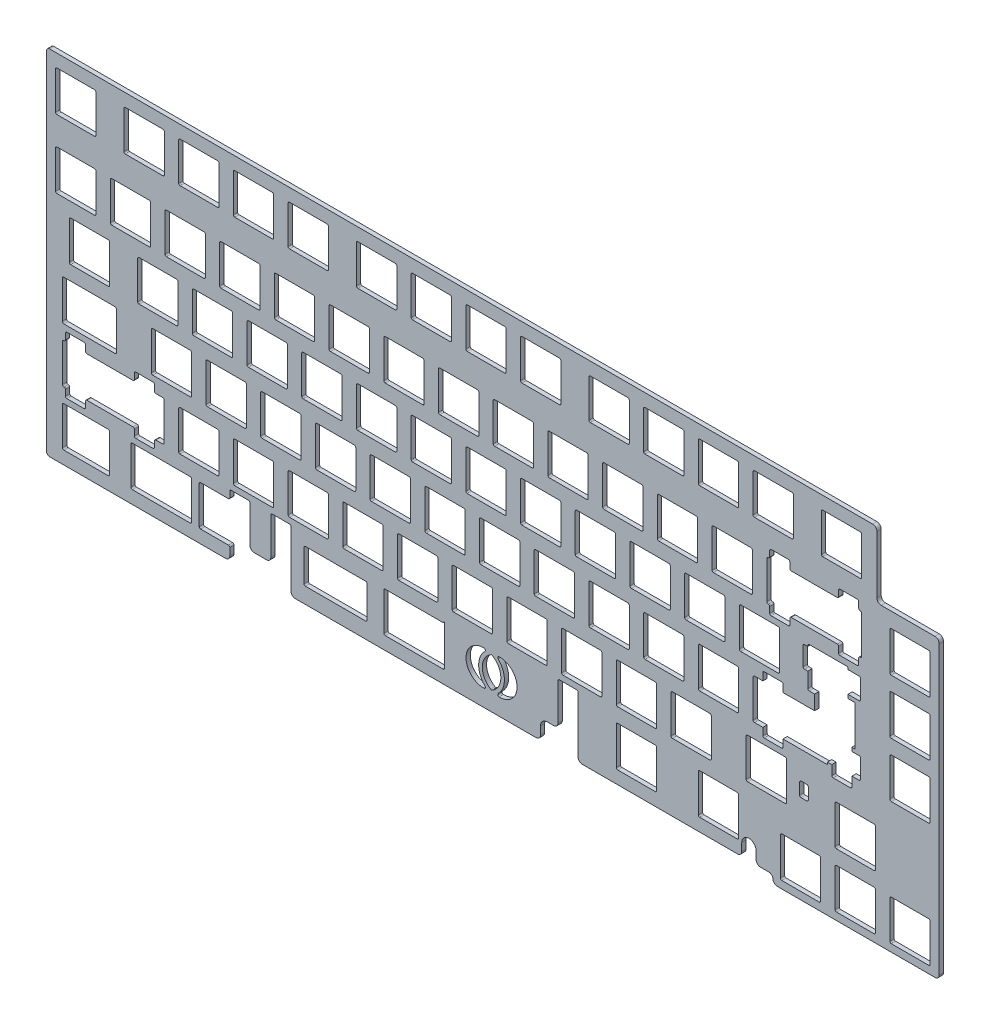
from build123d import *

# Parameters (mm, degrees)
BOSS_EXTRUDE1_DEPTH = 1.5
FILLET1_R           = 0.5


with BuildPart() as part:
    # Model → Boss-Extrude1 (new body)
    with BuildSketch(Plane.XY):
        with BuildLine():
            ThreePointArc((9.955298424, 130.969514546), (9.177480965, 130.647332005), (8.855298424, 129.869514546))
            Line((8.855298424, 129.869514546), (8.855298424, 9.057014546))
            ThreePointArc((8.855298424, 9.057014546), (9.177480965, 8.279197086), (9.955298424, 7.957014546))
            Line((9.955298424, 7.957014546), (71.206983424, 7.957014546))
            ThreePointArc((71.206983424, 7.957014546), (72.267643596, 8.396354374), (72.706983424, 9.457014546))
            Line((72.706983424, 9.457014546), (72.706983424, 11.957014546))
            ThreePointArc((72.706983424, 11.957014546), (72.560536815, 12.310567936), (72.206983424, 12.457014546))
            Line((72.206983424, 12.457014546), (62.559375038, 12.457014546))
            ThreePointArc((62.559375038, 12.457014546), (62.205821647, 12.603461155), (62.059375038, 12.957014546))
            Line((62.059375038, 12.957014546), (62.059375038, 25.957014546))
            ThreePointArc((62.059375038, 25.957014546), (62.205821647, 26.310567936), (62.559375038, 26.457014546))
            Line((62.559375038, 26.457014546), (72.206983424, 26.457014546))
            ThreePointArc((72.206983424, 26.457014546), (72.560536815, 26.603461155), (72.706983424, 26.957014546))
            Line((72.706983424, 26.957014546), (72.706983424, 28.958014546))
            ThreePointArc((72.706983424, 28.958014546), (72.853430033, 29.311567936), (73.206983424, 29.458014546))
            Line((73.206983424, 29.458014546), (79.206983424, 29.458014546))
            ThreePointArc((79.206983424, 29.458014546), (79.560536815, 29.311567936), (79.706983424, 28.958014546))
            Line((79.706983424, 28.958014546), (79.706983424, 16.157014546))
            ThreePointArc((79.706983424, 16.157014546), (80.146323252, 15.096354374), (81.206983424, 14.657014546))
            Line((81.206983424, 14.657014546), (85.495873424, 14.657014546))
            ThreePointArc((85.495873424, 14.657014546), (86.556533596, 15.096354374), (86.995873424, 16.157014546))
            Line((86.995873424, 16.157014546), (86.995873424, 28.958014546))
            ThreePointArc((86.995873424, 28.958014546), (87.142320033, 29.311567936), (87.495873424, 29.458014546))
            Line((87.495873424, 29.458014546), (93.495873424, 29.458014546))
            ThreePointArc((93.495873424, 29.458014546), (93.849426815, 29.311567936), (93.995873424, 28.958014546))
            Line((93.995873424, 28.958014546), (93.995873424, 9.457014546))
            ThreePointArc((93.995873424, 9.457014546), (94.435213252, 8.396354374), (95.495873424, 7.957014546))
            Line((95.495873424, 7.957014546), (179.362538424, 7.957014546))
            ThreePointArc((179.362538424, 7.957014546), (180.423198596, 8.396354374), (180.862538424, 9.457014546))
            Line((180.862538424, 9.457014546), (180.862538424, 12.157014546))
            ThreePointArc((180.862538424, 12.157014546), (181.594771471, 13.924781498), (183.362538424, 14.657014546))
            Line((183.362538424, 14.657014546), (185.495872282, 14.657014546))
            ThreePointArc((185.495872282, 14.657014546), (186.556532454, 15.096354374), (186.995872282, 16.157014546))
            Line((186.995872282, 16.157014546), (186.995872282, 28.958013975))
            ThreePointArc((186.995872282, 28.958013975), (187.14231869, 29.311567734), (187.495872282, 29.458014546))
            Line((187.495872282, 29.458014546), (193.495873424, 29.458014546))
            ThreePointArc((193.495873424, 29.458014546), (193.849426815, 29.311567936), (193.995873424, 28.958014546))
            Line((193.995873424, 28.958014546), (193.995873424, 9.457014546))
            ThreePointArc((193.995873424, 9.457014546), (194.435213252, 8.396354374), (195.495873424, 7.957014546))
            Line((195.495873424, 7.957014546), (249.492798424, 7.957014546))
            ThreePointArc((249.492798424, 7.957014546), (250.553458596, 8.396354374), (250.992798424, 9.457014546))
            Line((250.992798424, 9.457014546), (250.992798424, 12.157014546))
            ThreePointArc((250.992798424, 12.157014546), (253.492798424, 14.657014546), (255.992798424, 12.157014546))
            Line((255.992798424, 12.157014546), (255.992798424, 9.457014546))
            ThreePointArc((255.992798424, 9.457014546), (256.432138252, 8.396354374), (257.492798424, 7.957014546))
            Line((257.492798424, 7.957014546), (260.370951122, 7.957014546))
            ThreePointArc((260.370951122, 7.957014546), (261.407019411, 7.541709203), (261.869374773, 6.525764546))
            ThreePointArc((261.869374773, 6.525764546), (262.331730135, 5.509819888), (263.367798424, 5.094514546))
            Line((263.367798424, 5.094514546), (318.267798424, 5.094514546))
            ThreePointArc((318.267798424, 5.094514546), (319.328458596, 5.533854374), (319.767798424, 6.594514546))
            Line((319.767798424, 6.594514546), (319.767798424, 106.45317864))
            ThreePointArc((319.767798424, 106.45317864), (319.328458596, 107.513838812), (318.267798424, 107.95317864))
            Line((318.267798424, 107.95317864), (299.555298424, 107.95317864))
            ThreePointArc((299.555298424, 107.95317864), (298.494638252, 108.392518468), (298.055298424, 109.45317864))
            Line((298.055298424, 109.45317864), (298.055298424, 129.469514546))
            ThreePointArc((298.055298424, 129.469514546), (297.615958596, 130.530174717), (296.555298424, 130.969514546))
            Line((296.555298424, 130.969514546), (9.955298424, 130.969514546))
        make_face()
        with BuildLine():
            ThreePointArc((14.934285038, 12.457014546), (14.580731647, 12.603461155), (14.434285038, 12.957014546))
            Line((14.434285038, 12.957014546), (14.434285038, 25.957014546))
            ThreePointArc((14.434285038, 25.957014546), (14.580731647, 26.310567936), (14.934285038, 26.457014546))
            Line((14.934285038, 26.457014546), (30.319483424, 26.457014546))
            ThreePointArc((30.319483424, 26.457014546), (30.673036815, 26.310567936), (30.819483424, 25.957014546))
            Line((30.819483424, 25.957014546), (30.819483424, 12.957014546))
            ThreePointArc((30.819483424, 12.957014546), (30.673036815, 12.603461155), (30.319483424, 12.457014546))
            Line((30.319483424, 12.457014546), (14.934285038, 12.457014546))
        make_face(mode=Mode.SUBTRACT)
        with BuildLine():
            ThreePointArc((38.745375038, 12.457014546), (38.391821647, 12.603461155), (38.245375038, 12.957014546))
            Line((38.245375038, 12.957014546), (38.245375038, 25.957014546))
            ThreePointArc((38.245375038, 25.957014546), (38.391821647, 26.310567936), (38.745375038, 26.457014546))
            Line((38.745375038, 26.457014546), (58.894483424, 26.457014546))
            ThreePointArc((58.894483424, 26.457014546), (59.248036815, 26.310567936), (59.394483424, 25.957014546))
            Line((59.394483424, 25.957014546), (59.394483424, 12.957014546))
            ThreePointArc((59.394483424, 12.957014546), (59.248036815, 12.603461155), (58.894483424, 12.457014546))
            Line((58.894483424, 12.457014546), (38.745375038, 12.457014546))
        make_face(mode=Mode.SUBTRACT)
        with BuildLine():
            Line((120.541283424, 24.957014546), (120.541283424, 13.957014546))
            ThreePointArc((120.541283424, 13.957014546), (120.394836815, 13.603461155), (120.041283424, 13.457014546))
            Line((120.041283424, 13.457014546), (99.041283424, 13.457014546))
            ThreePointArc((99.041283424, 13.457014546), (98.687730033, 13.603461155), (98.541283424, 13.957014546))
            Line((98.541283424, 13.957014546), (98.541283424, 24.957014546))
            ThreePointArc((98.541283424, 24.957014546), (98.687730033, 25.310567936), (99.041283424, 25.457014546))
            Line((99.041283424, 25.457014546), (120.041283424, 25.457014546))
            ThreePointArc((120.041283424, 25.457014546), (120.394836815, 25.310567936), (120.541283424, 24.957014546))
        make_face(mode=Mode.SUBTRACT)
        with BuildLine():
            ThreePointArc((126.856983424, 12.457014546), (126.503430033, 12.603461155), (126.356983424, 12.957014546))
            Line((126.356983424, 12.957014546), (126.356983424, 25.957014546))
            ThreePointArc((126.356983424, 25.957014546), (126.503430033, 26.310567936), (126.856983424, 26.457014546))
            Line((126.856983424, 26.457014546), (146.995875038, 26.457014546))
            ThreePointArc((146.995875038, 26.457014546), (147.192055678, 26.702383251), (147.495875038, 26.782298463))
            Line((147.495875038, 26.782298463), (147.495875038, 12.957014546))
            ThreePointArc((147.495875038, 12.957014546), (147.349428429, 12.603461155), (146.995875038, 12.457014546))
            Line((146.995875038, 12.457014546), (126.856983424, 12.457014546))
        make_face(mode=Mode.SUBTRACT)
        with BuildLine():
            Line((15.463233424, 46.007014546), (15.463233424, 48.007314546))
            ThreePointArc((15.463233424, 48.007314546), (15.609680033, 48.360867936), (15.963233424, 48.507314546))
            Line((15.963233424, 48.507314546), (21.963233424, 48.507314546))
            ThreePointArc((21.963233424, 48.507314546), (22.316786815, 48.360867936), (22.463233424, 48.007314546))
            Line((22.463233424, 48.007314546), (22.463233424, 46.007314546))
            ThreePointArc((22.463233424, 46.007314546), (22.609680033, 45.653761155), (22.963233424, 45.507314546))
            Line((22.963233424, 45.507314546), (38.963233424, 45.507314546))
            ThreePointArc((38.963233424, 45.507314546), (39.316786815, 45.653761155), (39.463233424, 46.007314546))
            Line((39.463233424, 46.007314546), (39.463233424, 48.007314546))
            ThreePointArc((39.463233424, 48.007314546), (39.609680033, 48.360867936), (39.963233424, 48.507314546))
            Line((39.963233424, 48.507314546), (45.963233424, 48.507314546))
            ThreePointArc((45.963233424, 48.507314546), (46.316786815, 48.360867936), (46.463233424, 48.007314546))
            Line((46.463233424, 48.007314546), (46.463233424, 46.007014546))
            ThreePointArc((46.463233424, 46.007014546), (46.609680033, 45.653461155), (46.963233424, 45.507014546))
            Line((46.963233424, 45.507014546), (49.367798424, 45.507014546))
            ThreePointArc((49.367798424, 45.507014546), (49.721351815, 45.360567936), (49.867798424, 45.007014546))
            Line((49.867798424, 45.007014546), (49.867798424, 32.007014546))
            ThreePointArc((49.867798424, 32.007014546), (49.721351815, 31.653461155), (49.367798424, 31.507014546))
            Line((49.367798424, 31.507014546), (46.963233424, 31.507014546))
            ThreePointArc((46.963233424, 31.507014546), (46.609680033, 31.360567936), (46.463233424, 31.007014546))
            Line((46.463233424, 31.007014546), (46.463233424, 29.007314546))
            ThreePointArc((46.463233424, 29.007314546), (46.316786815, 28.653761155), (45.963233424, 28.507314546))
            Line((45.963233424, 28.507314546), (39.963233424, 28.507314546))
            ThreePointArc((39.963233424, 28.507314546), (39.609680033, 28.653761155), (39.463233424, 29.007314546))
            Line((39.463233424, 29.007314546), (39.463233424, 31.007314546))
            ThreePointArc((39.463233424, 31.007314546), (39.316786815, 31.360867936), (38.963233424, 31.507314546))
            Line((38.963233424, 31.507314546), (22.963233424, 31.507314546))
            ThreePointArc((22.963233424, 31.507314546), (22.609680033, 31.360867936), (22.463233424, 31.007314546))
            Line((22.463233424, 31.007314546), (22.463233424, 29.007314546))
            ThreePointArc((22.463233424, 29.007314546), (22.316786815, 28.653761155), (21.963233424, 28.507314546))
            Line((21.963233424, 28.507314546), (15.963233424, 28.507314546))
            ThreePointArc((15.963233424, 28.507314546), (15.609680033, 28.653761155), (15.463233424, 29.007314546))
            Line((15.463233424, 29.007314546), (15.463233424, 31.007014546))
            ThreePointArc((15.463233424, 31.007014546), (15.316786815, 31.360567936), (14.963233424, 31.507014546))
            Line((14.963233424, 31.507014546), (14.936548424, 31.507014546))
            ThreePointArc((14.936548424, 31.507014546), (14.582995033, 31.653461155), (14.436548424, 32.007014546))
            Line((14.436548424, 32.007014546), (14.436548424, 45.007014546))
            ThreePointArc((14.436548424, 45.007014546), (14.582995033, 45.360567936), (14.936548424, 45.507014546))
            Line((14.936548424, 45.507014546), (14.963233424, 45.507014546))
            ThreePointArc((14.963233424, 45.507014546), (15.316786815, 45.653461155), (15.463233424, 46.007014546))
        make_face(mode=Mode.SUBTRACT)
        with BuildLine():
            Line((68.442798424, 31.482014546), (55.392798424, 31.482014546))
            ThreePointArc((55.392798424, 31.482014546), (55.039245033, 31.628461155), (54.892798424, 31.982014546))
            Line((54.892798424, 31.982014546), (54.892798424, 45.032014546))
            ThreePointArc((54.892798424, 45.032014546), (55.039245033, 45.385567936), (55.392798424, 45.532014546))
            Line((55.392798424, 45.532014546), (68.442798424, 45.532014546))
            ThreePointArc((68.442798424, 45.532014546), (68.796351815, 45.385567936), (68.942798424, 45.032014546))
            Line((68.942798424, 45.032014546), (68.942798424, 31.982014546))
            ThreePointArc((68.942798424, 31.982014546), (68.796351815, 31.628461155), (68.442798424, 31.482014546))
        make_face(mode=Mode.SUBTRACT)
        with BuildLine():
            Line((87.492798424, 31.482014546), (74.442798424, 31.482014546))
            ThreePointArc((74.442798424, 31.482014546), (74.089245033, 31.628461155), (73.942798424, 31.982014546))
            Line((73.942798424, 31.982014546), (73.942798424, 45.032014546))
            ThreePointArc((73.942798424, 45.032014546), (74.089245033, 45.385567936), (74.442798424, 45.532014546))
            Line((74.442798424, 45.532014546), (87.492798424, 45.532014546))
            ThreePointArc((87.492798424, 45.532014546), (87.846351815, 45.385567936), (87.992798424, 45.032014546))
            Line((87.992798424, 45.032014546), (87.992798424, 31.982014546))
            ThreePointArc((87.992798424, 31.982014546), (87.846351815, 31.628461155), (87.492798424, 31.482014546))
        make_face(mode=Mode.SUBTRACT)
        with BuildLine():
            ThreePointArc((33.249048424, 51.057014546), (33.087957154, 50.668105816), (32.699048424, 50.507014546))
            Line((32.699048424, 50.507014546), (14.936548424, 50.507014546))
            ThreePointArc((14.936548424, 50.507014546), (14.547639694, 50.668105816), (14.386548424, 51.057014546))
            Line((14.386548424, 51.057014546), (14.386548424, 64.057014546))
            ThreePointArc((14.386548424, 64.057014546), (14.547639694, 64.445923275), (14.936548424, 64.607014546))
            Line((14.936548424, 64.607014546), (32.699048424, 64.607014546))
            ThreePointArc((32.699048424, 64.607014546), (33.087957154, 64.445923275), (33.249048424, 64.057014546))
            Line((33.249048424, 64.057014546), (33.249048424, 51.057014546))
        make_face(mode=Mode.SUBTRACT)
        with BuildLine():
            Line((58.917798424, 50.532014546), (45.867798424, 50.532014546))
            ThreePointArc((45.867798424, 50.532014546), (45.514245033, 50.678461155), (45.367798424, 51.032014546))
            Line((45.367798424, 51.032014546), (45.367798424, 64.082014546))
            ThreePointArc((45.367798424, 64.082014546), (45.514245033, 64.435567936), (45.867798424, 64.582014546))
            Line((45.867798424, 64.582014546), (58.917798424, 64.582014546))
            ThreePointArc((58.917798424, 64.582014546), (59.271351815, 64.435567936), (59.417798424, 64.082014546))
            Line((59.417798424, 64.082014546), (59.417798424, 51.032014546))
            ThreePointArc((59.417798424, 51.032014546), (59.271351815, 50.678461155), (58.917798424, 50.532014546))
        make_face(mode=Mode.SUBTRACT)
        with BuildLine():
            Line((77.967798424, 50.532014546), (64.917798424, 50.532014546))
            ThreePointArc((64.917798424, 50.532014546), (64.564245033, 50.678461155), (64.417798424, 51.032014546))
            Line((64.417798424, 51.032014546), (64.417798424, 64.082014546))
            ThreePointArc((64.417798424, 64.082014546), (64.564245033, 64.435567936), (64.917798424, 64.582014546))
            Line((64.917798424, 64.582014546), (77.967798424, 64.582014546))
            ThreePointArc((77.967798424, 64.582014546), (78.321351815, 64.435567936), (78.467798424, 64.082014546))
            Line((78.467798424, 64.082014546), (78.467798424, 51.032014546))
            ThreePointArc((78.467798424, 51.032014546), (78.321351815, 50.678461155), (77.967798424, 50.532014546))
        make_face(mode=Mode.SUBTRACT)
        with BuildLine():
            Line((106.542798424, 31.482014546), (93.492798424, 31.482014546))
            ThreePointArc((93.492798424, 31.482014546), (93.139245033, 31.628461155), (92.992798424, 31.982014546))
            Line((92.992798424, 31.982014546), (92.992798424, 45.032014546))
            ThreePointArc((92.992798424, 45.032014546), (93.139245033, 45.385567936), (93.492798424, 45.532014546))
            Line((93.492798424, 45.532014546), (106.542798424, 45.532014546))
            ThreePointArc((106.542798424, 45.532014546), (106.896351815, 45.385567936), (107.042798424, 45.032014546))
            Line((107.042798424, 45.032014546), (107.042798424, 31.982014546))
            ThreePointArc((107.042798424, 31.982014546), (106.896351815, 31.628461155), (106.542798424, 31.482014546))
        make_face(mode=Mode.SUBTRACT)
        with BuildLine():
            Line((125.592798424, 31.482014546), (112.542798424, 31.482014546))
            ThreePointArc((112.542798424, 31.482014546), (112.189245033, 31.628461155), (112.042798424, 31.982014546))
            Line((112.042798424, 31.982014546), (112.042798424, 45.032014546))
            ThreePointArc((112.042798424, 45.032014546), (112.189245033, 45.385567936), (112.542798424, 45.532014546))
            Line((112.542798424, 45.532014546), (125.592798424, 45.532014546))
            ThreePointArc((125.592798424, 45.532014546), (125.946351815, 45.385567936), (126.092798424, 45.032014546))
            Line((126.092798424, 45.032014546), (126.092798424, 31.982014546))
            ThreePointArc((126.092798424, 31.982014546), (125.946351815, 31.628461155), (125.592798424, 31.482014546))
        make_face(mode=Mode.SUBTRACT)
        with BuildLine():
            Line((144.642798424, 31.482014546), (131.592798424, 31.482014546))
            ThreePointArc((131.592798424, 31.482014546), (131.239245033, 31.628461155), (131.092798424, 31.982014546))
            Line((131.092798424, 31.982014546), (131.092798424, 45.032014546))
            ThreePointArc((131.092798424, 45.032014546), (131.239245033, 45.385567936), (131.592798424, 45.532014546))
            Line((131.592798424, 45.532014546), (144.642798424, 45.532014546))
            ThreePointArc((144.642798424, 45.532014546), (144.996351815, 45.385567936), (145.142798424, 45.032014546))
            Line((145.142798424, 45.032014546), (145.142798424, 31.982014546))
            ThreePointArc((145.142798424, 31.982014546), (144.996351815, 31.628461155), (144.642798424, 31.482014546))
        make_face(mode=Mode.SUBTRACT)
        with BuildLine():
            Line((163.692798424, 31.482014546), (150.642798424, 31.482014546))
            ThreePointArc((150.642798424, 31.482014546), (150.289245033, 31.628461155), (150.142798424, 31.982014546))
            Line((150.142798424, 31.982014546), (150.142798424, 45.032014546))
            ThreePointArc((150.142798424, 45.032014546), (150.289245033, 45.385567936), (150.642798424, 45.532014546))
            Line((150.642798424, 45.532014546), (163.692798424, 45.532014546))
            ThreePointArc((163.692798424, 45.532014546), (164.046351815, 45.385567936), (164.192798424, 45.032014546))
            Line((164.192798424, 45.032014546), (164.192798424, 31.982014546))
            ThreePointArc((164.192798424, 31.982014546), (164.046351815, 31.628461155), (163.692798424, 31.482014546))
        make_face(mode=Mode.SUBTRACT)
        with BuildLine():
            Line((97.017798424, 50.532014546), (83.967798424, 50.532014546))
            ThreePointArc((83.967798424, 50.532014546), (83.614245033, 50.678461155), (83.467798424, 51.032014546))
            Line((83.467798424, 51.032014546), (83.467798424, 64.082014546))
            ThreePointArc((83.467798424, 64.082014546), (83.614245033, 64.435567936), (83.967798424, 64.582014546))
            Line((83.967798424, 64.582014546), (97.017798424, 64.582014546))
            ThreePointArc((97.017798424, 64.582014546), (97.371351815, 64.435567936), (97.517798424, 64.082014546))
            Line((97.517798424, 64.082014546), (97.517798424, 51.032014546))
            ThreePointArc((97.517798424, 51.032014546), (97.371351815, 50.678461155), (97.017798424, 50.532014546))
        make_face(mode=Mode.SUBTRACT)
        with BuildLine():
            Line((116.067798424, 50.532014546), (103.017798424, 50.532014546))
            ThreePointArc((103.017798424, 50.532014546), (102.664245033, 50.678461155), (102.517798424, 51.032014546))
            Line((102.517798424, 51.032014546), (102.517798424, 64.082014546))
            ThreePointArc((102.517798424, 64.082014546), (102.664245033, 64.435567936), (103.017798424, 64.582014546))
            Line((103.017798424, 64.582014546), (116.067798424, 64.582014546))
            ThreePointArc((116.067798424, 64.582014546), (116.421351815, 64.435567936), (116.567798424, 64.082014546))
            Line((116.567798424, 64.082014546), (116.567798424, 51.032014546))
            ThreePointArc((116.567798424, 51.032014546), (116.421351815, 50.678461155), (116.067798424, 50.532014546))
        make_face(mode=Mode.SUBTRACT)
        with BuildLine():
            Line((135.117798424, 50.532014546), (122.067798424, 50.532014546))
            ThreePointArc((122.067798424, 50.532014546), (121.714245033, 50.678461155), (121.567798424, 51.032014546))
            Line((121.567798424, 51.032014546), (121.567798424, 64.082014546))
            ThreePointArc((121.567798424, 64.082014546), (121.714245033, 64.435567936), (122.067798424, 64.582014546))
            Line((122.067798424, 64.582014546), (135.117798424, 64.582014546))
            ThreePointArc((135.117798424, 64.582014546), (135.471351815, 64.435567936), (135.617798424, 64.082014546))
            Line((135.617798424, 64.082014546), (135.617798424, 51.032014546))
            ThreePointArc((135.617798424, 51.032014546), (135.471351815, 50.678461155), (135.117798424, 50.532014546))
        make_face(mode=Mode.SUBTRACT)
        with BuildLine():
            Line((154.167798424, 50.532014546), (141.117798424, 50.532014546))
            ThreePointArc((141.117798424, 50.532014546), (140.764245033, 50.678461155), (140.617798424, 51.032014546))
            Line((140.617798424, 51.032014546), (140.617798424, 64.082014546))
            ThreePointArc((140.617798424, 64.082014546), (140.764245033, 64.435567936), (141.117798424, 64.582014546))
            Line((141.117798424, 64.582014546), (154.167798424, 64.582014546))
            ThreePointArc((154.167798424, 64.582014546), (154.521351815, 64.435567936), (154.667798424, 64.082014546))
            Line((154.667798424, 64.082014546), (154.667798424, 51.032014546))
            ThreePointArc((154.667798424, 51.032014546), (154.521351815, 50.678461155), (154.167798424, 50.532014546))
        make_face(mode=Mode.SUBTRACT)
        with BuildLine():
            Line((220.842798424, 12.432014546), (207.792798424, 12.432014546))
            ThreePointArc((207.792798424, 12.432014546), (207.439245033, 12.578461155), (207.292798424, 12.932014546))
            Line((207.292798424, 12.932014546), (207.292798424, 25.982014546))
            ThreePointArc((207.292798424, 25.982014546), (207.439245033, 26.335567936), (207.792798424, 26.482014546))
            Line((207.792798424, 26.482014546), (220.842798424, 26.482014546))
            ThreePointArc((220.842798424, 26.482014546), (221.196351815, 26.335567936), (221.342798424, 25.982014546))
            Line((221.342798424, 25.982014546), (221.342798424, 12.932014546))
            ThreePointArc((221.342798424, 12.932014546), (221.196351815, 12.578461155), (220.842798424, 12.432014546))
        make_face(mode=Mode.SUBTRACT)
        with BuildLine():
            Line((249.417798424, 12.432014546), (236.367798424, 12.432014546))
            ThreePointArc((236.367798424, 12.432014546), (236.014245033, 12.578461155), (235.867798424, 12.932014546))
            Line((235.867798424, 12.932014546), (235.867798424, 25.982014546))
            ThreePointArc((235.867798424, 25.982014546), (236.014245033, 26.335567936), (236.367798424, 26.482014546))
            Line((236.367798424, 26.482014546), (249.417798424, 26.482014546))
            ThreePointArc((249.417798424, 26.482014546), (249.771351815, 26.335567936), (249.917798424, 25.982014546))
            Line((249.917798424, 25.982014546), (249.917798424, 12.932014546))
            ThreePointArc((249.917798424, 12.932014546), (249.771351815, 12.578461155), (249.417798424, 12.432014546))
        make_face(mode=Mode.SUBTRACT)
        with BuildLine():
            Line((277.992798424, 7.669514546), (264.942798424, 7.669514546))
            ThreePointArc((264.942798424, 7.669514546), (264.589245033, 7.815961155), (264.442798424, 8.169514546))
            Line((264.442798424, 8.169514546), (264.442798424, 21.219514546))
            ThreePointArc((264.442798424, 21.219514546), (264.589245033, 21.573067936), (264.942798424, 21.719514546))
            Line((264.942798424, 21.719514546), (277.992798424, 21.719514546))
            ThreePointArc((277.992798424, 21.719514546), (278.346351815, 21.573067936), (278.492798424, 21.219514546))
            Line((278.492798424, 21.219514546), (278.492798424, 8.169514546))
            ThreePointArc((278.492798424, 8.169514546), (278.346351815, 7.815961155), (277.992798424, 7.669514546))
        make_face(mode=Mode.SUBTRACT)
        with BuildLine():
            Line((297.042798424, 7.669514546), (283.992798424, 7.669514546))
            ThreePointArc((283.992798424, 7.669514546), (283.639245033, 7.815961155), (283.492798424, 8.169514546))
            Line((283.492798424, 8.169514546), (283.492798424, 21.219514546))
            ThreePointArc((283.492798424, 21.219514546), (283.639245033, 21.573067936), (283.992798424, 21.719514546))
            Line((283.992798424, 21.719514546), (297.042798424, 21.719514546))
            ThreePointArc((297.042798424, 21.719514546), (297.396351815, 21.573067936), (297.542798424, 21.219514546))
            Line((297.542798424, 21.219514546), (297.542798424, 8.169514546))
            ThreePointArc((297.542798424, 8.169514546), (297.396351815, 7.815961155), (297.042798424, 7.669514546))
        make_face(mode=Mode.SUBTRACT)
        with BuildLine():
            Line((316.092798424, 7.669514546), (303.042798424, 7.669514546))
            ThreePointArc((303.042798424, 7.669514546), (302.689245033, 7.815961155), (302.542798424, 8.169514546))
            Line((302.542798424, 8.169514546), (302.542798424, 21.219514546))
            ThreePointArc((302.542798424, 21.219514546), (302.689245033, 21.573067936), (303.042798424, 21.719514546))
            Line((303.042798424, 21.719514546), (316.092798424, 21.719514546))
            ThreePointArc((316.092798424, 21.719514546), (316.446351815, 21.573067936), (316.592798424, 21.219514546))
            Line((316.592798424, 21.219514546), (316.592798424, 8.169514546))
            ThreePointArc((316.592798424, 8.169514546), (316.446351815, 7.815961155), (316.092798424, 7.669514546))
        make_face(mode=Mode.SUBTRACT)
        with BuildLine():
            Line((297.042798424, 26.719514546), (283.992798424, 26.719514546))
            ThreePointArc((283.992798424, 26.719514546), (283.639245033, 26.865961155), (283.492798424, 27.219514546))
            Line((283.492798424, 27.219514546), (283.492798424, 40.269514546))
            ThreePointArc((283.492798424, 40.269514546), (283.639245033, 40.623067936), (283.992798424, 40.769514546))
            Line((283.992798424, 40.769514546), (297.042798424, 40.769514546))
            ThreePointArc((297.042798424, 40.769514546), (297.396351815, 40.623067936), (297.542798424, 40.269514546))
            Line((297.542798424, 40.269514546), (297.542798424, 27.219514546))
            ThreePointArc((297.542798424, 27.219514546), (297.396351815, 26.865961155), (297.042798424, 26.719514546))
        make_face(mode=Mode.SUBTRACT)
        with BuildLine():
            Line((182.742798424, 31.482014546), (169.692798424, 31.482014546))
            ThreePointArc((169.692798424, 31.482014546), (169.339245033, 31.628461155), (169.192798424, 31.982014546))
            Line((169.192798424, 31.982014546), (169.192798424, 45.032014546))
            ThreePointArc((169.192798424, 45.032014546), (169.339245033, 45.385567936), (169.692798424, 45.532014546))
            Line((169.692798424, 45.532014546), (182.742798424, 45.532014546))
            ThreePointArc((182.742798424, 45.532014546), (183.096351815, 45.385567936), (183.242798424, 45.032014546))
            Line((183.242798424, 45.032014546), (183.242798424, 31.982014546))
            ThreePointArc((183.242798424, 31.982014546), (183.096351815, 31.628461155), (182.742798424, 31.482014546))
        make_face(mode=Mode.SUBTRACT)
        with BuildLine():
            Line((201.792798424, 31.482014546), (188.742798424, 31.482014546))
            ThreePointArc((188.742798424, 31.482014546), (188.389245033, 31.628461155), (188.242798424, 31.982014546))
            Line((188.242798424, 31.982014546), (188.242798424, 45.032014546))
            ThreePointArc((188.242798424, 45.032014546), (188.389245033, 45.385567936), (188.742798424, 45.532014546))
            Line((188.742798424, 45.532014546), (201.792798424, 45.532014546))
            ThreePointArc((201.792798424, 45.532014546), (202.146351815, 45.385567936), (202.292798424, 45.032014546))
            Line((202.292798424, 45.032014546), (202.292798424, 31.982014546))
            ThreePointArc((202.292798424, 31.982014546), (202.146351815, 31.628461155), (201.792798424, 31.482014546))
        make_face(mode=Mode.SUBTRACT)
        with BuildLine():
            Line((220.842798424, 31.482014546), (207.792798424, 31.482014546))
            ThreePointArc((207.792798424, 31.482014546), (207.439245033, 31.628461155), (207.292798424, 31.982014546))
            Line((207.292798424, 31.982014546), (207.292798424, 45.032014546))
            ThreePointArc((207.292798424, 45.032014546), (207.439245033, 45.385567936), (207.792798424, 45.532014546))
            Line((207.792798424, 45.532014546), (220.842798424, 45.532014546))
            ThreePointArc((220.842798424, 45.532014546), (221.196351815, 45.385567936), (221.342798424, 45.032014546))
            Line((221.342798424, 45.032014546), (221.342798424, 31.982014546))
            ThreePointArc((221.342798424, 31.982014546), (221.196351815, 31.628461155), (220.842798424, 31.482014546))
        make_face(mode=Mode.SUBTRACT)
        with BuildLine():
            Line((239.892798424, 31.482014546), (226.842798424, 31.482014546))
            ThreePointArc((226.842798424, 31.482014546), (226.489245033, 31.628461155), (226.342798424, 31.982014546))
            Line((226.342798424, 31.982014546), (226.342798424, 45.032014546))
            ThreePointArc((226.342798424, 45.032014546), (226.489245033, 45.385567936), (226.842798424, 45.532014546))
            Line((226.842798424, 45.532014546), (239.892798424, 45.532014546))
            ThreePointArc((239.892798424, 45.532014546), (240.246351815, 45.385567936), (240.392798424, 45.032014546))
            Line((240.392798424, 45.032014546), (240.392798424, 31.982014546))
            ThreePointArc((240.392798424, 31.982014546), (240.246351815, 31.628461155), (239.892798424, 31.482014546))
        make_face(mode=Mode.SUBTRACT)
        with BuildLine():
            Line((173.217798424, 50.532014546), (160.167798424, 50.532014546))
            ThreePointArc((160.167798424, 50.532014546), (159.814245033, 50.678461155), (159.667798424, 51.032014546))
            Line((159.667798424, 51.032014546), (159.667798424, 64.082014546))
            ThreePointArc((159.667798424, 64.082014546), (159.814245033, 64.435567936), (160.167798424, 64.582014546))
            Line((160.167798424, 64.582014546), (173.217798424, 64.582014546))
            ThreePointArc((173.217798424, 64.582014546), (173.571351815, 64.435567936), (173.717798424, 64.082014546))
            Line((173.717798424, 64.082014546), (173.717798424, 51.032014546))
            ThreePointArc((173.717798424, 51.032014546), (173.571351815, 50.678461155), (173.217798424, 50.532014546))
        make_face(mode=Mode.SUBTRACT)
        with BuildLine():
            Line((192.267798424, 50.532014546), (179.217798424, 50.532014546))
            ThreePointArc((179.217798424, 50.532014546), (178.864245033, 50.678461155), (178.717798424, 51.032014546))
            Line((178.717798424, 51.032014546), (178.717798424, 64.082014546))
            ThreePointArc((178.717798424, 64.082014546), (178.864245033, 64.435567936), (179.217798424, 64.582014546))
            Line((179.217798424, 64.582014546), (192.267798424, 64.582014546))
            ThreePointArc((192.267798424, 64.582014546), (192.621351815, 64.435567936), (192.767798424, 64.082014546))
            Line((192.767798424, 64.082014546), (192.767798424, 51.032014546))
            ThreePointArc((192.767798424, 51.032014546), (192.621351815, 50.678461155), (192.267798424, 50.532014546))
        make_face(mode=Mode.SUBTRACT)
        with BuildLine():
            Line((211.317798424, 50.532014546), (198.267798424, 50.532014546))
            ThreePointArc((198.267798424, 50.532014546), (197.914245033, 50.678461155), (197.767798424, 51.032014546))
            Line((197.767798424, 51.032014546), (197.767798424, 64.082014546))
            ThreePointArc((197.767798424, 64.082014546), (197.914245033, 64.435567936), (198.267798424, 64.582014546))
            Line((198.267798424, 64.582014546), (211.317798424, 64.582014546))
            ThreePointArc((211.317798424, 64.582014546), (211.671351815, 64.435567936), (211.817798424, 64.082014546))
            Line((211.817798424, 64.082014546), (211.817798424, 51.032014546))
            ThreePointArc((211.817798424, 51.032014546), (211.671351815, 50.678461155), (211.317798424, 50.532014546))
        make_face(mode=Mode.SUBTRACT)
        with BuildLine():
            Line((230.367798424, 50.532014546), (217.317798424, 50.532014546))
            ThreePointArc((217.317798424, 50.532014546), (216.964245033, 50.678461155), (216.817798424, 51.032014546))
            Line((216.817798424, 51.032014546), (216.817798424, 64.082014546))
            ThreePointArc((216.817798424, 64.082014546), (216.964245033, 64.435567936), (217.317798424, 64.582014546))
            Line((217.317798424, 64.582014546), (230.367798424, 64.582014546))
            ThreePointArc((230.367798424, 64.582014546), (230.721351815, 64.435567936), (230.867798424, 64.082014546))
            Line((230.867798424, 64.082014546), (230.867798424, 51.032014546))
            ThreePointArc((230.867798424, 51.032014546), (230.721351815, 50.678461155), (230.367798424, 50.532014546))
        make_face(mode=Mode.SUBTRACT)
        with BuildLine():
            Line((266.086548424, 31.482014546), (253.036548424, 31.482014546))
            ThreePointArc((253.036548424, 31.482014546), (252.682995033, 31.628461155), (252.536548424, 31.982014546))
            Line((252.536548424, 31.982014546), (252.536548424, 45.032014546))
            ThreePointArc((252.536548424, 45.032014546), (252.682995033, 45.385567936), (253.036548424, 45.532014546))
            Line((253.036548424, 45.532014546), (266.086548424, 45.532014546))
            ThreePointArc((266.086548424, 45.532014546), (266.440101815, 45.385567936), (266.586548424, 45.032014546))
            Line((266.586548424, 45.032014546), (266.586548424, 31.982014546))
            ThreePointArc((266.586548424, 31.982014546), (266.440101815, 31.628461155), (266.086548424, 31.482014546))
        make_face(mode=Mode.SUBTRACT)
        with BuildLine():
            ThreePointArc((271.157173424, 40.507014546), (271.303620033, 40.860567936), (271.657173424, 41.007014546))
            Line((271.657173424, 41.007014546), (273.657173424, 41.007014546))
            ThreePointArc((273.657173424, 41.007014546), (274.010726815, 40.860567936), (274.157173424, 40.507014546))
            Line((274.157173424, 40.507014546), (274.157173424, 36.507014546))
            ThreePointArc((274.157173424, 36.507014546), (274.010726815, 36.153461155), (273.657173424, 36.007014546))
            Line((273.657173424, 36.007014546), (271.657173424, 36.007014546))
            ThreePointArc((271.657173424, 36.007014546), (271.303620033, 36.153461155), (271.157173424, 36.507014546))
            Line((271.157173424, 36.507014546), (271.157173424, 40.507014546))
        make_face(mode=Mode.SUBTRACT)
        with BuildLine():
            Line((249.417798424, 50.532014546), (236.367798424, 50.532014546))
            ThreePointArc((236.367798424, 50.532014546), (236.014245033, 50.678461155), (235.867798424, 51.032014546))
            Line((235.867798424, 51.032014546), (235.867798424, 64.082014546))
            ThreePointArc((235.867798424, 64.082014546), (236.014245033, 64.435567936), (236.367798424, 64.582014546))
            Line((236.367798424, 64.582014546), (249.417798424, 64.582014546))
            ThreePointArc((249.417798424, 64.582014546), (249.771351815, 64.435567936), (249.917798424, 64.082014546))
            Line((249.917798424, 64.082014546), (249.917798424, 51.032014546))
            ThreePointArc((249.917798424, 51.032014546), (249.771351815, 50.678461155), (249.417798424, 50.532014546))
        make_face(mode=Mode.SUBTRACT)
        with BuildLine():
            ThreePointArc((273.992798424, 83.107014546), (274.139245033, 83.460567936), (274.492798424, 83.607014546))
            Line((274.492798424, 83.607014546), (287.492798424, 83.607014546))
            ThreePointArc((287.492798424, 83.607014546), (287.846351815, 83.460567936), (287.992798424, 83.107014546))
            Line((287.992798424, 83.107014546), (287.995298424, 82.780068193))
            Line((287.995298424, 82.780068193), (291.850783424, 82.780068193))
            ThreePointArc((291.850783424, 82.780068193), (292.204336815, 82.633621584), (292.350783424, 82.280068193))
            Line((292.350783424, 82.280068193), (292.350783424, 75.842068193))
            ThreePointArc((292.350783424, 75.842068193), (292.204336815, 75.488514803), (291.850783424, 75.342068193))
            Line((291.850783424, 75.342068193), (287.995298424, 75.342068193))
            Line((287.995298424, 75.342068193), (287.995298424, 74.061068193))
            Line((287.995298424, 74.061068193), (290.376548424, 74.061068193))
            Line((290.376548424, 74.061068193), (290.376548424, 60.061068193))
            Line((290.376548424, 60.061068193), (289.350783424, 60.061068193))
            Line((289.350783424, 60.061068193), (289.350783424, 58.780068193))
            Line((289.350783424, 58.780068193), (291.850783424, 58.780068193))
            ThreePointArc((291.850783424, 58.780068193), (292.204336815, 58.633621584), (292.350783424, 58.280068193))
            Line((292.350783424, 58.280068193), (292.350783424, 51.842068193))
            ThreePointArc((292.350783424, 51.842068193), (292.204336815, 51.488514803), (291.850783424, 51.342068193))
            Line((291.850783424, 51.342068193), (289.350783424, 51.342068193))
            Line((289.350783424, 51.342068193), (289.350783424, 48.057014546))
            ThreePointArc((289.350783424, 48.057014546), (289.204336815, 47.703461155), (288.850783424, 47.557014546))
            Line((288.850783424, 47.557014546), (282.850783424, 47.557014546))
            ThreePointArc((282.850783424, 47.557014546), (282.497230033, 47.703461155), (282.350783424, 48.057014546))
            Line((282.350783424, 48.057014546), (282.350783424, 51.342068193))
            Line((282.350783424, 51.342068193), (280.851598424, 51.342068193))
            Line((280.851598424, 51.342068193), (280.851598424, 50.557014546))
            Line((280.851598424, 50.557014546), (265.350783424, 50.557014546))
            Line((265.350783424, 50.557014546), (265.350783424, 48.057014546))
            ThreePointArc((265.350783424, 48.057014546), (265.204336815, 47.703461155), (264.850783424, 47.557014546))
            Line((264.850783424, 47.557014546), (258.850783424, 47.557014546))
            ThreePointArc((258.850783424, 47.557014546), (258.497230033, 47.703461155), (258.350783424, 48.057014546))
            Line((258.350783424, 48.057014546), (258.350783424, 50.557014546))
            Line((258.350783424, 50.557014546), (255.445298424, 50.557014546))
            ThreePointArc((255.445298424, 50.557014546), (255.091745033, 50.703461155), (254.945298424, 51.057014546))
            Line((254.945298424, 51.057014546), (254.945298424, 64.057014546))
            ThreePointArc((254.945298424, 64.057014546), (255.091745033, 64.410567936), (255.445298424, 64.557014546))
            Line((255.445298424, 64.557014546), (258.350783424, 64.557014546))
            Line((258.350783424, 64.557014546), (258.350783424, 67.057014546))
            ThreePointArc((258.350783424, 67.057014546), (258.497230033, 67.410567936), (258.850783424, 67.557014546))
            Line((258.850783424, 67.557014546), (264.850783424, 67.557014546))
            ThreePointArc((264.850783424, 67.557014546), (265.204336815, 67.410567936), (265.350783424, 67.057014546))
            Line((265.350783424, 67.057014546), (265.350783424, 64.557014546))
            Line((265.350783424, 64.557014546), (276.376548424, 64.557014546))
            Line((276.376548424, 64.557014546), (276.376548424, 69.607014546))
            Line((276.376548424, 69.607014546), (274.492798424, 69.607014546))
            ThreePointArc((274.492798424, 69.607014546), (274.139245033, 69.753461155), (273.992798424, 70.107014546))
            Line((273.992798424, 70.107014546), (273.992798424, 75.342068193))
            Line((273.992798424, 75.342068193), (272.850783424, 75.342068193))
            ThreePointArc((272.850783424, 75.342068193), (272.497230033, 75.488514803), (272.350783424, 75.842068193))
            Line((272.350783424, 75.842068193), (272.350783424, 82.280068193))
            ThreePointArc((272.350783424, 82.280068193), (272.497230033, 82.633621584), (272.850783424, 82.780068193))
            Line((272.850783424, 82.780068193), (273.992798424, 82.780068193))
            Line((273.992798424, 82.780068193), (273.992798424, 83.107014546))
        make_face(mode=Mode.SUBTRACT)
        with BuildLine():
            ThreePointArc((302.542798424, 64.057014546), (302.696567364, 64.428245606), (303.067798424, 64.582014546))
            Line((303.067798424, 64.582014546), (316.117798424, 64.582014546))
            ThreePointArc((316.117798424, 64.582014546), (316.453674145, 64.442890267), (316.592798424, 64.107014546))
            Line((316.592798424, 64.107014546), (316.592798424, 51.057014546))
            ThreePointArc((316.592798424, 51.057014546), (316.439029484, 50.685783485), (316.067798424, 50.532014546))
            Line((316.067798424, 50.532014546), (303.067798424, 50.532014546))
            ThreePointArc((303.067798424, 50.532014546), (302.696567364, 50.685783485), (302.542798424, 51.057014546))
            Line((302.542798424, 51.057014546), (302.542798424, 64.057014546))
        make_face(mode=Mode.SUBTRACT)
        with BuildLine():
            Line((30.342798424, 69.582014546), (17.292798424, 69.582014546))
            ThreePointArc((17.292798424, 69.582014546), (16.939245033, 69.728461155), (16.792798424, 70.082014546))
            Line((16.792798424, 70.082014546), (16.792798424, 83.132014546))
            ThreePointArc((16.792798424, 83.132014546), (16.939245033, 83.485567936), (17.292798424, 83.632014546))
            Line((17.292798424, 83.632014546), (30.342798424, 83.632014546))
            ThreePointArc((30.342798424, 83.632014546), (30.696351815, 83.485567936), (30.842798424, 83.132014546))
            Line((30.842798424, 83.132014546), (30.842798424, 70.082014546))
            ThreePointArc((30.842798424, 70.082014546), (30.696351815, 69.728461155), (30.342798424, 69.582014546))
        make_face(mode=Mode.SUBTRACT)
        with BuildLine():
            Line((54.155298424, 69.582014546), (41.105298424, 69.582014546))
            ThreePointArc((41.105298424, 69.582014546), (40.751745033, 69.728461155), (40.605298424, 70.082014546))
            Line((40.605298424, 70.082014546), (40.605298424, 83.132014546))
            ThreePointArc((40.605298424, 83.132014546), (40.751745033, 83.485567936), (41.105298424, 83.632014546))
            Line((41.105298424, 83.632014546), (54.155298424, 83.632014546))
            ThreePointArc((54.155298424, 83.632014546), (54.508851815, 83.485567936), (54.655298424, 83.132014546))
            Line((54.655298424, 83.132014546), (54.655298424, 70.082014546))
            ThreePointArc((54.655298424, 70.082014546), (54.508851815, 69.728461155), (54.155298424, 69.582014546))
        make_face(mode=Mode.SUBTRACT)
        with BuildLine():
            Line((73.205298424, 69.582014546), (60.155298424, 69.582014546))
            ThreePointArc((60.155298424, 69.582014546), (59.801745033, 69.728461155), (59.655298424, 70.082014546))
            Line((59.655298424, 70.082014546), (59.655298424, 83.132014546))
            ThreePointArc((59.655298424, 83.132014546), (59.801745033, 83.485567936), (60.155298424, 83.632014546))
            Line((60.155298424, 83.632014546), (73.205298424, 83.632014546))
            ThreePointArc((73.205298424, 83.632014546), (73.558851815, 83.485567936), (73.705298424, 83.132014546))
            Line((73.705298424, 83.132014546), (73.705298424, 70.082014546))
            ThreePointArc((73.705298424, 70.082014546), (73.558851815, 69.728461155), (73.205298424, 69.582014546))
        make_face(mode=Mode.SUBTRACT)
        with BuildLine():
            Line((92.255298424, 69.582014546), (79.205298424, 69.582014546))
            ThreePointArc((79.205298424, 69.582014546), (78.851745033, 69.728461155), (78.705298424, 70.082014546))
            Line((78.705298424, 70.082014546), (78.705298424, 83.132014546))
            ThreePointArc((78.705298424, 83.132014546), (78.851745033, 83.485567936), (79.205298424, 83.632014546))
            Line((79.205298424, 83.632014546), (92.255298424, 83.632014546))
            ThreePointArc((92.255298424, 83.632014546), (92.608851815, 83.485567936), (92.755298424, 83.132014546))
            Line((92.755298424, 83.132014546), (92.755298424, 70.082014546))
            ThreePointArc((92.755298424, 70.082014546), (92.608851815, 69.728461155), (92.255298424, 69.582014546))
        make_face(mode=Mode.SUBTRACT)
        with BuildLine():
            Line((25.580298424, 88.632014546), (12.530298424, 88.632014546))
            ThreePointArc((12.530298424, 88.632014546), (12.176745033, 88.778461155), (12.030298424, 89.132014546))
            Line((12.030298424, 89.132014546), (12.030298424, 102.182014546))
            ThreePointArc((12.030298424, 102.182014546), (12.176745033, 102.535567936), (12.530298424, 102.682014546))
            Line((12.530298424, 102.682014546), (25.580298424, 102.682014546))
            ThreePointArc((25.580298424, 102.682014546), (25.933851815, 102.535567936), (26.080298424, 102.182014546))
            Line((26.080298424, 102.182014546), (26.080298424, 89.132014546))
            ThreePointArc((26.080298424, 89.132014546), (25.933851815, 88.778461155), (25.580298424, 88.632014546))
        make_face(mode=Mode.SUBTRACT)
        with BuildLine():
            Line((44.630298424, 88.632014546), (31.580298424, 88.632014546))
            ThreePointArc((31.580298424, 88.632014546), (31.226745033, 88.778461155), (31.080298424, 89.132014546))
            Line((31.080298424, 89.132014546), (31.080298424, 102.182014546))
            ThreePointArc((31.080298424, 102.182014546), (31.226745033, 102.535567936), (31.580298424, 102.682014546))
            Line((31.580298424, 102.682014546), (44.630298424, 102.682014546))
            ThreePointArc((44.630298424, 102.682014546), (44.983851815, 102.535567936), (45.130298424, 102.182014546))
            Line((45.130298424, 102.182014546), (45.130298424, 89.132014546))
            ThreePointArc((45.130298424, 89.132014546), (44.983851815, 88.778461155), (44.630298424, 88.632014546))
        make_face(mode=Mode.SUBTRACT)
        with BuildLine():
            Line((63.680298424, 88.632014546), (50.630298424, 88.632014546))
            ThreePointArc((50.630298424, 88.632014546), (50.276745033, 88.778461155), (50.130298424, 89.132014546))
            Line((50.130298424, 89.132014546), (50.130298424, 102.182014546))
            ThreePointArc((50.130298424, 102.182014546), (50.276745033, 102.535567936), (50.630298424, 102.682014546))
            Line((50.630298424, 102.682014546), (63.680298424, 102.682014546))
            ThreePointArc((63.680298424, 102.682014546), (64.033851815, 102.535567936), (64.180298424, 102.182014546))
            Line((64.180298424, 102.182014546), (64.180298424, 89.132014546))
            ThreePointArc((64.180298424, 89.132014546), (64.033851815, 88.778461155), (63.680298424, 88.632014546))
        make_face(mode=Mode.SUBTRACT)
        with BuildLine():
            Line((82.730298424, 88.632014546), (69.680298424, 88.632014546))
            ThreePointArc((69.680298424, 88.632014546), (69.326745033, 88.778461155), (69.180298424, 89.132014546))
            Line((69.180298424, 89.132014546), (69.180298424, 102.182014546))
            ThreePointArc((69.180298424, 102.182014546), (69.326745033, 102.535567936), (69.680298424, 102.682014546))
            Line((69.680298424, 102.682014546), (82.730298424, 102.682014546))
            ThreePointArc((82.730298424, 102.682014546), (83.083851815, 102.535567936), (83.230298424, 102.182014546))
            Line((83.230298424, 102.182014546), (83.230298424, 89.132014546))
            ThreePointArc((83.230298424, 89.132014546), (83.083851815, 88.778461155), (82.730298424, 88.632014546))
        make_face(mode=Mode.SUBTRACT)
        with BuildLine():
            Line((111.305298424, 69.582014546), (98.255298424, 69.582014546))
            ThreePointArc((98.255298424, 69.582014546), (97.901745033, 69.728461155), (97.755298424, 70.082014546))
            Line((97.755298424, 70.082014546), (97.755298424, 83.132014546))
            ThreePointArc((97.755298424, 83.132014546), (97.901745033, 83.485567936), (98.255298424, 83.632014546))
            Line((98.255298424, 83.632014546), (111.305298424, 83.632014546))
            ThreePointArc((111.305298424, 83.632014546), (111.658851815, 83.485567936), (111.805298424, 83.132014546))
            Line((111.805298424, 83.132014546), (111.805298424, 70.082014546))
            ThreePointArc((111.805298424, 70.082014546), (111.658851815, 69.728461155), (111.305298424, 69.582014546))
        make_face(mode=Mode.SUBTRACT)
        with BuildLine():
            Line((130.355298424, 69.582014546), (117.305298424, 69.582014546))
            ThreePointArc((117.305298424, 69.582014546), (116.951745033, 69.728461155), (116.805298424, 70.082014546))
            Line((116.805298424, 70.082014546), (116.805298424, 83.132014546))
            ThreePointArc((116.805298424, 83.132014546), (116.951745033, 83.485567936), (117.305298424, 83.632014546))
            Line((117.305298424, 83.632014546), (130.355298424, 83.632014546))
            ThreePointArc((130.355298424, 83.632014546), (130.708851815, 83.485567936), (130.855298424, 83.132014546))
            Line((130.855298424, 83.132014546), (130.855298424, 70.082014546))
            ThreePointArc((130.855298424, 70.082014546), (130.708851815, 69.728461155), (130.355298424, 69.582014546))
        make_face(mode=Mode.SUBTRACT)
        with BuildLine():
            Line((149.405298424, 69.582014546), (136.355298424, 69.582014546))
            ThreePointArc((136.355298424, 69.582014546), (136.001745033, 69.728461155), (135.855298424, 70.082014546))
            Line((135.855298424, 70.082014546), (135.855298424, 83.132014546))
            ThreePointArc((135.855298424, 83.132014546), (136.001745033, 83.485567936), (136.355298424, 83.632014546))
            Line((136.355298424, 83.632014546), (149.405298424, 83.632014546))
            ThreePointArc((149.405298424, 83.632014546), (149.758851815, 83.485567936), (149.905298424, 83.132014546))
            Line((149.905298424, 83.132014546), (149.905298424, 70.082014546))
            ThreePointArc((149.905298424, 70.082014546), (149.758851815, 69.728461155), (149.405298424, 69.582014546))
        make_face(mode=Mode.SUBTRACT)
        with BuildLine():
            Line((168.455298424, 69.582014546), (155.405298424, 69.582014546))
            ThreePointArc((155.405298424, 69.582014546), (155.051745033, 69.728461155), (154.905298424, 70.082014546))
            Line((154.905298424, 70.082014546), (154.905298424, 83.132014546))
            ThreePointArc((154.905298424, 83.132014546), (155.051745033, 83.485567936), (155.405298424, 83.632014546))
            Line((155.405298424, 83.632014546), (168.455298424, 83.632014546))
            ThreePointArc((168.455298424, 83.632014546), (168.808851815, 83.485567936), (168.955298424, 83.132014546))
            Line((168.955298424, 83.132014546), (168.955298424, 70.082014546))
            ThreePointArc((168.955298424, 70.082014546), (168.808851815, 69.728461155), (168.455298424, 69.582014546))
        make_face(mode=Mode.SUBTRACT)
        with BuildLine():
            Line((101.780298424, 88.632014546), (88.730298424, 88.632014546))
            ThreePointArc((88.730298424, 88.632014546), (88.376745033, 88.778461155), (88.230298424, 89.132014546))
            Line((88.230298424, 89.132014546), (88.230298424, 102.182014546))
            ThreePointArc((88.230298424, 102.182014546), (88.376745033, 102.535567936), (88.730298424, 102.682014546))
            Line((88.730298424, 102.682014546), (101.780298424, 102.682014546))
            ThreePointArc((101.780298424, 102.682014546), (102.133851815, 102.535567936), (102.280298424, 102.182014546))
            Line((102.280298424, 102.182014546), (102.280298424, 89.132014546))
            ThreePointArc((102.280298424, 89.132014546), (102.133851815, 88.778461155), (101.780298424, 88.632014546))
        make_face(mode=Mode.SUBTRACT)
        with BuildLine():
            Line((120.830298424, 88.632014546), (107.780298424, 88.632014546))
            ThreePointArc((107.780298424, 88.632014546), (107.426745033, 88.778461155), (107.280298424, 89.132014546))
            Line((107.280298424, 89.132014546), (107.280298424, 102.182014546))
            ThreePointArc((107.280298424, 102.182014546), (107.426745033, 102.535567936), (107.780298424, 102.682014546))
            Line((107.780298424, 102.682014546), (120.830298424, 102.682014546))
            ThreePointArc((120.830298424, 102.682014546), (121.183851815, 102.535567936), (121.330298424, 102.182014546))
            Line((121.330298424, 102.182014546), (121.330298424, 89.132014546))
            ThreePointArc((121.330298424, 89.132014546), (121.183851815, 88.778461155), (120.830298424, 88.632014546))
        make_face(mode=Mode.SUBTRACT)
        with BuildLine():
            Line((139.880298424, 88.632014546), (126.830298424, 88.632014546))
            ThreePointArc((126.830298424, 88.632014546), (126.476745033, 88.778461155), (126.330298424, 89.132014546))
            Line((126.330298424, 89.132014546), (126.330298424, 102.182014546))
            ThreePointArc((126.330298424, 102.182014546), (126.476745033, 102.535567936), (126.830298424, 102.682014546))
            Line((126.830298424, 102.682014546), (139.880298424, 102.682014546))
            ThreePointArc((139.880298424, 102.682014546), (140.233851815, 102.535567936), (140.380298424, 102.182014546))
            Line((140.380298424, 102.182014546), (140.380298424, 89.132014546))
            ThreePointArc((140.380298424, 89.132014546), (140.233851815, 88.778461155), (139.880298424, 88.632014546))
        make_face(mode=Mode.SUBTRACT)
        with BuildLine():
            Line((158.930298424, 88.632014546), (145.880298424, 88.632014546))
            ThreePointArc((145.880298424, 88.632014546), (145.526745033, 88.778461155), (145.380298424, 89.132014546))
            Line((145.380298424, 89.132014546), (145.380298424, 102.182014546))
            ThreePointArc((145.380298424, 102.182014546), (145.526745033, 102.535567936), (145.880298424, 102.682014546))
            Line((145.880298424, 102.682014546), (158.930298424, 102.682014546))
            ThreePointArc((158.930298424, 102.682014546), (159.283851815, 102.535567936), (159.430298424, 102.182014546))
            Line((159.430298424, 102.182014546), (159.430298424, 89.132014546))
            ThreePointArc((159.430298424, 89.132014546), (159.283851815, 88.778461155), (158.930298424, 88.632014546))
        make_face(mode=Mode.SUBTRACT)
        with BuildLine():
            Line((25.580298424, 112.444514546), (12.530298424, 112.444514546))
            ThreePointArc((12.530298424, 112.444514546), (12.176745033, 112.590961155), (12.030298424, 112.944514546))
            Line((12.030298424, 112.944514546), (12.030298424, 125.994514546))
            ThreePointArc((12.030298424, 125.994514546), (12.176745033, 126.348067936), (12.530298424, 126.494514546))
            Line((12.530298424, 126.494514546), (25.580298424, 126.494514546))
            ThreePointArc((25.580298424, 126.494514546), (25.933851815, 126.348067936), (26.080298424, 125.994514546))
            Line((26.080298424, 125.994514546), (26.080298424, 112.944514546))
            ThreePointArc((26.080298424, 112.944514546), (25.933851815, 112.590961155), (25.580298424, 112.444514546))
        make_face(mode=Mode.SUBTRACT)
        with BuildLine():
            Line((49.392798424, 112.444514546), (36.342798424, 112.444514546))
            ThreePointArc((36.342798424, 112.444514546), (35.989245033, 112.590961155), (35.842798424, 112.944514546))
            Line((35.842798424, 112.944514546), (35.842798424, 125.994514546))
            ThreePointArc((35.842798424, 125.994514546), (35.989245033, 126.348067936), (36.342798424, 126.494514546))
            Line((36.342798424, 126.494514546), (49.392798424, 126.494514546))
            ThreePointArc((49.392798424, 126.494514546), (49.746351815, 126.348067936), (49.892798424, 125.994514546))
            Line((49.892798424, 125.994514546), (49.892798424, 112.944514546))
            ThreePointArc((49.892798424, 112.944514546), (49.746351815, 112.590961155), (49.392798424, 112.444514546))
        make_face(mode=Mode.SUBTRACT)
        with BuildLine():
            Line((68.442798424, 112.444514546), (55.392798424, 112.444514546))
            ThreePointArc((55.392798424, 112.444514546), (55.039245033, 112.590961155), (54.892798424, 112.944514546))
            Line((54.892798424, 112.944514546), (54.892798424, 125.994514546))
            ThreePointArc((54.892798424, 125.994514546), (55.039245033, 126.348067936), (55.392798424, 126.494514546))
            Line((55.392798424, 126.494514546), (68.442798424, 126.494514546))
            ThreePointArc((68.442798424, 126.494514546), (68.796351815, 126.348067936), (68.942798424, 125.994514546))
            Line((68.942798424, 125.994514546), (68.942798424, 112.944514546))
            ThreePointArc((68.942798424, 112.944514546), (68.796351815, 112.590961155), (68.442798424, 112.444514546))
        make_face(mode=Mode.SUBTRACT)
        with BuildLine():
            Line((87.492798424, 112.444514546), (74.442798424, 112.444514546))
            ThreePointArc((74.442798424, 112.444514546), (74.089245033, 112.590961155), (73.942798424, 112.944514546))
            Line((73.942798424, 112.944514546), (73.942798424, 125.994514546))
            ThreePointArc((73.942798424, 125.994514546), (74.089245033, 126.348067936), (74.442798424, 126.494514546))
            Line((74.442798424, 126.494514546), (87.492798424, 126.494514546))
            ThreePointArc((87.492798424, 126.494514546), (87.846351815, 126.348067936), (87.992798424, 125.994514546))
            Line((87.992798424, 125.994514546), (87.992798424, 112.944514546))
            ThreePointArc((87.992798424, 112.944514546), (87.846351815, 112.590961155), (87.492798424, 112.444514546))
        make_face(mode=Mode.SUBTRACT)
        with BuildLine():
            Line((106.542798424, 112.444514546), (93.492798424, 112.444514546))
            ThreePointArc((93.492798424, 112.444514546), (93.139245033, 112.590961155), (92.992798424, 112.944514546))
            Line((92.992798424, 112.944514546), (92.992798424, 125.994514546))
            ThreePointArc((92.992798424, 125.994514546), (93.139245033, 126.348067936), (93.492798424, 126.494514546))
            Line((93.492798424, 126.494514546), (106.542798424, 126.494514546))
            ThreePointArc((106.542798424, 126.494514546), (106.896351815, 126.348067936), (107.042798424, 125.994514546))
            Line((107.042798424, 125.994514546), (107.042798424, 112.944514546))
            ThreePointArc((107.042798424, 112.944514546), (106.896351815, 112.590961155), (106.542798424, 112.444514546))
        make_face(mode=Mode.SUBTRACT)
        with BuildLine():
            Line((130.355298424, 112.444514546), (117.305298424, 112.444514546))
            ThreePointArc((117.305298424, 112.444514546), (116.951745033, 112.590961155), (116.805298424, 112.944514546))
            Line((116.805298424, 112.944514546), (116.805298424, 125.994514546))
            ThreePointArc((116.805298424, 125.994514546), (116.951745033, 126.348067936), (117.305298424, 126.494514546))
            Line((117.305298424, 126.494514546), (130.355298424, 126.494514546))
            ThreePointArc((130.355298424, 126.494514546), (130.708851815, 126.348067936), (130.855298424, 125.994514546))
            Line((130.855298424, 125.994514546), (130.855298424, 112.944514546))
            ThreePointArc((130.855298424, 112.944514546), (130.708851815, 112.590961155), (130.355298424, 112.444514546))
        make_face(mode=Mode.SUBTRACT)
        with BuildLine():
            Line((149.405298424, 112.444514546), (136.355298424, 112.444514546))
            ThreePointArc((136.355298424, 112.444514546), (136.001745033, 112.590961155), (135.855298424, 112.944514546))
            Line((135.855298424, 112.944514546), (135.855298424, 125.994514546))
            ThreePointArc((135.855298424, 125.994514546), (136.001745033, 126.348067936), (136.355298424, 126.494514546))
            Line((136.355298424, 126.494514546), (149.405298424, 126.494514546))
            ThreePointArc((149.405298424, 126.494514546), (149.758851815, 126.348067936), (149.905298424, 125.994514546))
            Line((149.905298424, 125.994514546), (149.905298424, 112.944514546))
            ThreePointArc((149.905298424, 112.944514546), (149.758851815, 112.590961155), (149.405298424, 112.444514546))
        make_face(mode=Mode.SUBTRACT)
        with BuildLine():
            Line((168.455298424, 112.444514546), (155.405298424, 112.444514546))
            ThreePointArc((155.405298424, 112.444514546), (155.051745033, 112.590961155), (154.905298424, 112.944514546))
            Line((154.905298424, 112.944514546), (154.905298424, 125.994514546))
            ThreePointArc((154.905298424, 125.994514546), (155.051745033, 126.348067936), (155.405298424, 126.494514546))
            Line((155.405298424, 126.494514546), (168.455298424, 126.494514546))
            ThreePointArc((168.455298424, 126.494514546), (168.808851815, 126.348067936), (168.955298424, 125.994514546))
            Line((168.955298424, 125.994514546), (168.955298424, 112.944514546))
            ThreePointArc((168.955298424, 112.944514546), (168.808851815, 112.590961155), (168.455298424, 112.444514546))
        make_face(mode=Mode.SUBTRACT)
        with BuildLine():
            Line((187.505298424, 69.582014546), (174.455298424, 69.582014546))
            ThreePointArc((174.455298424, 69.582014546), (174.101745033, 69.728461155), (173.955298424, 70.082014546))
            Line((173.955298424, 70.082014546), (173.955298424, 83.132014546))
            ThreePointArc((173.955298424, 83.132014546), (174.101745033, 83.485567936), (174.455298424, 83.632014546))
            Line((174.455298424, 83.632014546), (187.505298424, 83.632014546))
            ThreePointArc((187.505298424, 83.632014546), (187.858851815, 83.485567936), (188.005298424, 83.132014546))
            Line((188.005298424, 83.132014546), (188.005298424, 70.082014546))
            ThreePointArc((188.005298424, 70.082014546), (187.858851815, 69.728461155), (187.505298424, 69.582014546))
        make_face(mode=Mode.SUBTRACT)
        with BuildLine():
            Line((206.555298424, 69.582014546), (193.505298424, 69.582014546))
            ThreePointArc((193.505298424, 69.582014546), (193.151745033, 69.728461155), (193.005298424, 70.082014546))
            Line((193.005298424, 70.082014546), (193.005298424, 83.132014546))
            ThreePointArc((193.005298424, 83.132014546), (193.151745033, 83.485567936), (193.505298424, 83.632014546))
            Line((193.505298424, 83.632014546), (206.555298424, 83.632014546))
            ThreePointArc((206.555298424, 83.632014546), (206.908851815, 83.485567936), (207.055298424, 83.132014546))
            Line((207.055298424, 83.132014546), (207.055298424, 70.082014546))
            ThreePointArc((207.055298424, 70.082014546), (206.908851815, 69.728461155), (206.555298424, 69.582014546))
        make_face(mode=Mode.SUBTRACT)
        with BuildLine():
            Line((225.605298424, 69.582014546), (212.555298424, 69.582014546))
            ThreePointArc((212.555298424, 69.582014546), (212.201745033, 69.728461155), (212.055298424, 70.082014546))
            Line((212.055298424, 70.082014546), (212.055298424, 83.132014546))
            ThreePointArc((212.055298424, 83.132014546), (212.201745033, 83.485567936), (212.555298424, 83.632014546))
            Line((212.555298424, 83.632014546), (225.605298424, 83.632014546))
            ThreePointArc((225.605298424, 83.632014546), (225.958851815, 83.485567936), (226.105298424, 83.132014546))
            Line((226.105298424, 83.132014546), (226.105298424, 70.082014546))
            ThreePointArc((226.105298424, 70.082014546), (225.958851815, 69.728461155), (225.605298424, 69.582014546))
        make_face(mode=Mode.SUBTRACT)
        with BuildLine():
            Line((244.655298424, 69.582014546), (231.605298424, 69.582014546))
            ThreePointArc((231.605298424, 69.582014546), (231.251745033, 69.728461155), (231.105298424, 70.082014546))
            Line((231.105298424, 70.082014546), (231.105298424, 83.132014546))
            ThreePointArc((231.105298424, 83.132014546), (231.251745033, 83.485567936), (231.605298424, 83.632014546))
            Line((231.605298424, 83.632014546), (244.655298424, 83.632014546))
            ThreePointArc((244.655298424, 83.632014546), (245.008851815, 83.485567936), (245.155298424, 83.132014546))
            Line((245.155298424, 83.132014546), (245.155298424, 70.082014546))
            ThreePointArc((245.155298424, 70.082014546), (245.008851815, 69.728461155), (244.655298424, 69.582014546))
        make_face(mode=Mode.SUBTRACT)
        with BuildLine():
            Line((177.980298424, 88.632014546), (164.930298424, 88.632014546))
            ThreePointArc((164.930298424, 88.632014546), (164.576745033, 88.778461155), (164.430298424, 89.132014546))
            Line((164.430298424, 89.132014546), (164.430298424, 102.182014546))
            ThreePointArc((164.430298424, 102.182014546), (164.576745033, 102.535567936), (164.930298424, 102.682014546))
            Line((164.930298424, 102.682014546), (177.980298424, 102.682014546))
            ThreePointArc((177.980298424, 102.682014546), (178.333851815, 102.535567936), (178.480298424, 102.182014546))
            Line((178.480298424, 102.182014546), (178.480298424, 89.132014546))
            ThreePointArc((178.480298424, 89.132014546), (178.333851815, 88.778461155), (177.980298424, 88.632014546))
        make_face(mode=Mode.SUBTRACT)
        with BuildLine():
            Line((197.030298424, 88.632014546), (183.980298424, 88.632014546))
            ThreePointArc((183.980298424, 88.632014546), (183.626745033, 88.778461155), (183.480298424, 89.132014546))
            Line((183.480298424, 89.132014546), (183.480298424, 102.182014546))
            ThreePointArc((183.480298424, 102.182014546), (183.626745033, 102.535567936), (183.980298424, 102.682014546))
            Line((183.980298424, 102.682014546), (197.030298424, 102.682014546))
            ThreePointArc((197.030298424, 102.682014546), (197.383851815, 102.535567936), (197.530298424, 102.182014546))
            Line((197.530298424, 102.182014546), (197.530298424, 89.132014546))
            ThreePointArc((197.530298424, 89.132014546), (197.383851815, 88.778461155), (197.030298424, 88.632014546))
        make_face(mode=Mode.SUBTRACT)
        with BuildLine():
            Line((216.080298424, 88.632014546), (203.030298424, 88.632014546))
            ThreePointArc((203.030298424, 88.632014546), (202.676745033, 88.778461155), (202.530298424, 89.132014546))
            Line((202.530298424, 89.132014546), (202.530298424, 102.182014546))
            ThreePointArc((202.530298424, 102.182014546), (202.676745033, 102.535567936), (203.030298424, 102.682014546))
            Line((203.030298424, 102.682014546), (216.080298424, 102.682014546))
            ThreePointArc((216.080298424, 102.682014546), (216.433851815, 102.535567936), (216.580298424, 102.182014546))
            Line((216.580298424, 102.182014546), (216.580298424, 89.132014546))
            ThreePointArc((216.580298424, 89.132014546), (216.433851815, 88.778461155), (216.080298424, 88.632014546))
        make_face(mode=Mode.SUBTRACT)
        with BuildLine():
            Line((235.130298424, 88.632014546), (222.080298424, 88.632014546))
            ThreePointArc((222.080298424, 88.632014546), (221.726745033, 88.778461155), (221.580298424, 89.132014546))
            Line((221.580298424, 89.132014546), (221.580298424, 102.182014546))
            ThreePointArc((221.580298424, 102.182014546), (221.726745033, 102.535567936), (222.080298424, 102.682014546))
            Line((222.080298424, 102.682014546), (235.130298424, 102.682014546))
            ThreePointArc((235.130298424, 102.682014546), (235.483851815, 102.535567936), (235.630298424, 102.182014546))
            Line((235.630298424, 102.182014546), (235.630298424, 89.132014546))
            ThreePointArc((235.630298424, 89.132014546), (235.483851815, 88.778461155), (235.130298424, 88.632014546))
        make_face(mode=Mode.SUBTRACT)
        with BuildLine():
            Line((263.705298424, 69.582014546), (250.655298424, 69.582014546))
            ThreePointArc((250.655298424, 69.582014546), (250.301745033, 69.728461155), (250.155298424, 70.082014546))
            Line((250.155298424, 70.082014546), (250.155298424, 83.132014546))
            ThreePointArc((250.155298424, 83.132014546), (250.301745033, 83.485567936), (250.655298424, 83.632014546))
            Line((250.655298424, 83.632014546), (263.705298424, 83.632014546))
            ThreePointArc((263.705298424, 83.632014546), (264.058851815, 83.485567936), (264.205298424, 83.132014546))
            Line((264.205298424, 83.132014546), (264.205298424, 70.082014546))
            ThreePointArc((264.205298424, 70.082014546), (264.058851815, 69.728461155), (263.705298424, 69.582014546))
        make_face(mode=Mode.SUBTRACT)
        with BuildLine():
            Line((316.092798424, 69.582014546), (303.042798424, 69.582014546))
            ThreePointArc((303.042798424, 69.582014546), (302.689245033, 69.728461155), (302.542798424, 70.082014546))
            Line((302.542798424, 70.082014546), (302.542798424, 83.132014546))
            ThreePointArc((302.542798424, 83.132014546), (302.689245033, 83.485567936), (303.042798424, 83.632014546))
            Line((303.042798424, 83.632014546), (316.092798424, 83.632014546))
            ThreePointArc((316.092798424, 83.632014546), (316.446351815, 83.485567936), (316.592798424, 83.132014546))
            Line((316.592798424, 83.132014546), (316.592798424, 70.082014546))
            ThreePointArc((316.592798424, 70.082014546), (316.446351815, 69.728461155), (316.092798424, 69.582014546))
        make_face(mode=Mode.SUBTRACT)
        with BuildLine():
            Line((254.180298424, 88.632014546), (241.130298424, 88.632014546))
            ThreePointArc((241.130298424, 88.632014546), (240.776745033, 88.778461155), (240.630298424, 89.132014546))
            Line((240.630298424, 89.132014546), (240.630298424, 102.182014546))
            ThreePointArc((240.630298424, 102.182014546), (240.776745033, 102.535567936), (241.130298424, 102.682014546))
            Line((241.130298424, 102.682014546), (254.180298424, 102.682014546))
            ThreePointArc((254.180298424, 102.682014546), (254.533851815, 102.535567936), (254.680298424, 102.182014546))
            Line((254.680298424, 102.182014546), (254.680298424, 89.132014546))
            ThreePointArc((254.680298424, 89.132014546), (254.533851815, 88.778461155), (254.180298424, 88.632014546))
        make_face(mode=Mode.SUBTRACT)
        with BuildLine():
            Line((260.729483424, 103.157014546), (260.729483424, 105.157014546))
            ThreePointArc((260.729483424, 105.157014546), (260.875930033, 105.510567936), (261.229483424, 105.657014546))
            Line((261.229483424, 105.657014546), (267.229483424, 105.657014546))
            ThreePointArc((267.229483424, 105.657014546), (267.583036815, 105.510567936), (267.729483424, 105.157014546))
            Line((267.729483424, 105.157014546), (267.729483424, 103.157014546))
            ThreePointArc((267.729483424, 103.157014546), (267.875930033, 102.803461155), (268.229483424, 102.657014546))
            Line((268.229483424, 102.657014546), (284.229483424, 102.657014546))
            ThreePointArc((284.229483424, 102.657014546), (284.583036815, 102.803461155), (284.729483424, 103.157014546))
            Line((284.729483424, 103.157014546), (284.729483424, 105.157014546))
            ThreePointArc((284.729483424, 105.157014546), (284.875930033, 105.510567936), (285.229483424, 105.657014546))
            Line((285.229483424, 105.657014546), (291.229483424, 105.657014546))
            ThreePointArc((291.229483424, 105.657014546), (291.583036815, 105.510567936), (291.729483424, 105.157014546))
            Line((291.729483424, 105.157014546), (291.729483424, 103.157014546))
            ThreePointArc((291.729483424, 103.157014546), (291.875930033, 102.803461155), (292.229483424, 102.657014546))
            Line((292.229483424, 102.657014546), (292.255298424, 102.657014546))
            ThreePointArc((292.255298424, 102.657014546), (292.608851815, 102.510567936), (292.755298424, 102.157014546))
            Line((292.755298424, 102.157014546), (292.755298424, 89.157014546))
            ThreePointArc((292.755298424, 89.157014546), (292.608851815, 88.803461155), (292.255298424, 88.657014546))
            Line((292.255298424, 88.657014546), (292.229483424, 88.657014546))
            ThreePointArc((292.229483424, 88.657014546), (291.875930033, 88.510567936), (291.729483424, 88.157014546))
            Line((291.729483424, 88.157014546), (291.729483424, 86.157014546))
            ThreePointArc((291.729483424, 86.157014546), (291.583036815, 85.803461155), (291.229483424, 85.657014546))
            Line((291.229483424, 85.657014546), (285.229483424, 85.657014546))
            ThreePointArc((285.229483424, 85.657014546), (284.875930033, 85.803461155), (284.729483424, 86.157014546))
            Line((284.729483424, 86.157014546), (284.729483424, 88.157014546))
            ThreePointArc((284.729483424, 88.157014546), (284.583036815, 88.510567936), (284.229483424, 88.657014546))
            Line((284.229483424, 88.657014546), (268.229483424, 88.657014546))
            ThreePointArc((268.229483424, 88.657014546), (267.875930033, 88.510567936), (267.729483424, 88.157014546))
            Line((267.729483424, 88.157014546), (267.729483424, 86.157014546))
            ThreePointArc((267.729483424, 86.157014546), (267.583036815, 85.803461155), (267.229483424, 85.657014546))
            Line((267.229483424, 85.657014546), (261.229483424, 85.657014546))
            ThreePointArc((261.229483424, 85.657014546), (260.875930033, 85.803461155), (260.729483424, 86.157014546))
            Line((260.729483424, 86.157014546), (260.729483424, 88.157014546))
            ThreePointArc((260.729483424, 88.157014546), (260.583036815, 88.510567936), (260.229483424, 88.657014546))
            Line((260.229483424, 88.657014546), (260.205298424, 88.657014546))
            ThreePointArc((260.205298424, 88.657014546), (259.851745033, 88.803461155), (259.705298424, 89.157014546))
            Line((259.705298424, 89.157014546), (259.705298424, 102.157014546))
            ThreePointArc((259.705298424, 102.157014546), (259.851745033, 102.510567936), (260.205298424, 102.657014546))
            Line((260.205298424, 102.657014546), (260.229483424, 102.657014546))
            ThreePointArc((260.229483424, 102.657014546), (260.583036815, 102.803461155), (260.729483424, 103.157014546))
        make_face(mode=Mode.SUBTRACT)
        with BuildLine():
            Line((316.092798424, 88.632014546), (303.042798424, 88.632014546))
            ThreePointArc((303.042798424, 88.632014546), (302.689245033, 88.778461155), (302.542798424, 89.132014546))
            Line((302.542798424, 89.132014546), (302.542798424, 102.182014546))
            ThreePointArc((302.542798424, 102.182014546), (302.689245033, 102.535567936), (303.042798424, 102.682014546))
            Line((303.042798424, 102.682014546), (316.092798424, 102.682014546))
            ThreePointArc((316.092798424, 102.682014546), (316.446351815, 102.535567936), (316.592798424, 102.182014546))
            Line((316.592798424, 102.182014546), (316.592798424, 89.132014546))
            ThreePointArc((316.592798424, 89.132014546), (316.446351815, 88.778461155), (316.092798424, 88.632014546))
        make_face(mode=Mode.SUBTRACT)
        with BuildLine():
            Line((187.505298424, 112.444514546), (174.455298424, 112.444514546))
            ThreePointArc((174.455298424, 112.444514546), (174.101745033, 112.590961155), (173.955298424, 112.944514546))
            Line((173.955298424, 112.944514546), (173.955298424, 125.994514546))
            ThreePointArc((173.955298424, 125.994514546), (174.101745033, 126.348067936), (174.455298424, 126.494514546))
            Line((174.455298424, 126.494514546), (187.505298424, 126.494514546))
            ThreePointArc((187.505298424, 126.494514546), (187.858851815, 126.348067936), (188.005298424, 125.994514546))
            Line((188.005298424, 125.994514546), (188.005298424, 112.944514546))
            ThreePointArc((188.005298424, 112.944514546), (187.858851815, 112.590961155), (187.505298424, 112.444514546))
        make_face(mode=Mode.SUBTRACT)
        with BuildLine():
            Line((211.317798424, 112.444514546), (198.267798424, 112.444514546))
            ThreePointArc((198.267798424, 112.444514546), (197.914245033, 112.590961155), (197.767798424, 112.944514546))
            Line((197.767798424, 112.944514546), (197.767798424, 125.994514546))
            ThreePointArc((197.767798424, 125.994514546), (197.914245033, 126.348067936), (198.267798424, 126.494514546))
            Line((198.267798424, 126.494514546), (211.317798424, 126.494514546))
            ThreePointArc((211.317798424, 126.494514546), (211.671351815, 126.348067936), (211.817798424, 125.994514546))
            Line((211.817798424, 125.994514546), (211.817798424, 112.944514546))
            ThreePointArc((211.817798424, 112.944514546), (211.671351815, 112.590961155), (211.317798424, 112.444514546))
        make_face(mode=Mode.SUBTRACT)
        with BuildLine():
            Line((230.367798424, 112.444514546), (217.317798424, 112.444514546))
            ThreePointArc((217.317798424, 112.444514546), (216.964245033, 112.590961155), (216.817798424, 112.944514546))
            Line((216.817798424, 112.944514546), (216.817798424, 125.994514546))
            ThreePointArc((216.817798424, 125.994514546), (216.964245033, 126.348067936), (217.317798424, 126.494514546))
            Line((217.317798424, 126.494514546), (230.367798424, 126.494514546))
            ThreePointArc((230.367798424, 126.494514546), (230.721351815, 126.348067936), (230.867798424, 125.994514546))
            Line((230.867798424, 125.994514546), (230.867798424, 112.944514546))
            ThreePointArc((230.867798424, 112.944514546), (230.721351815, 112.590961155), (230.367798424, 112.444514546))
        make_face(mode=Mode.SUBTRACT)
        with BuildLine():
            Line((249.417798424, 112.444514546), (236.367798424, 112.444514546))
            ThreePointArc((236.367798424, 112.444514546), (236.014245033, 112.590961155), (235.867798424, 112.944514546))
            Line((235.867798424, 112.944514546), (235.867798424, 125.994514546))
            ThreePointArc((235.867798424, 125.994514546), (236.014245033, 126.348067936), (236.367798424, 126.494514546))
            Line((236.367798424, 126.494514546), (249.417798424, 126.494514546))
            ThreePointArc((249.417798424, 126.494514546), (249.771351815, 126.348067936), (249.917798424, 125.994514546))
            Line((249.917798424, 125.994514546), (249.917798424, 112.944514546))
            ThreePointArc((249.917798424, 112.944514546), (249.771351815, 112.590961155), (249.417798424, 112.444514546))
        make_face(mode=Mode.SUBTRACT)
        with BuildLine():
            Line((268.467798424, 112.444514546), (255.417798424, 112.444514546))
            ThreePointArc((255.417798424, 112.444514546), (255.064245033, 112.590961155), (254.917798424, 112.944514546))
            Line((254.917798424, 112.944514546), (254.917798424, 125.994514546))
            ThreePointArc((254.917798424, 125.994514546), (255.064245033, 126.348067936), (255.417798424, 126.494514546))
            Line((255.417798424, 126.494514546), (268.467798424, 126.494514546))
            ThreePointArc((268.467798424, 126.494514546), (268.821351815, 126.348067936), (268.967798424, 125.994514546))
            Line((268.967798424, 125.994514546), (268.967798424, 112.944514546))
            ThreePointArc((268.967798424, 112.944514546), (268.821351815, 112.590961155), (268.467798424, 112.444514546))
        make_face(mode=Mode.SUBTRACT)
        with BuildLine():
            Line((292.280298424, 112.444514546), (279.230298424, 112.444514546))
            ThreePointArc((279.230298424, 112.444514546), (278.876745033, 112.590961155), (278.730298424, 112.944514546))
            Line((278.730298424, 112.944514546), (278.730298424, 125.994514546))
            ThreePointArc((278.730298424, 125.994514546), (278.876745033, 126.348067936), (279.230298424, 126.494514546))
            Line((279.230298424, 126.494514546), (292.280298424, 126.494514546))
            ThreePointArc((292.280298424, 126.494514546), (292.633851815, 126.348067936), (292.780298424, 125.994514546))
            Line((292.780298424, 125.994514546), (292.780298424, 112.944514546))
            ThreePointArc((292.780298424, 112.944514546), (292.633851815, 112.590961155), (292.280298424, 112.444514546))
        make_face(mode=Mode.SUBTRACT)
        with BuildLine():
            ThreePointArc((162.378136909, 13.955031353), (154.971647669, 19.869656504), (162.378136909, 25.784281656))
            ThreePointArc((162.378136909, 25.784281656), (159.367284437, 19.869656504), (162.378136909, 13.955031353))
        make_face(mode=Mode.SUBTRACT)
        with BuildLine():
            ThreePointArc((165.340546641, 13.955031353), (168.351399112, 19.869656504), (165.340546641, 25.784281656))
            ThreePointArc((165.340546641, 25.784281656), (172.74703588, 19.869656504), (165.340546641, 13.955031353))
        make_face(mode=Mode.SUBTRACT)
        with BuildLine():
            ThreePointArc((163.859341775, 25.237562417), (167.101399112, 19.869656504), (163.859341775, 14.501750592))
            ThreePointArc((163.859341775, 14.501750592), (160.617284437, 19.869656504), (163.859341775, 25.237562417))
        make_face(mode=Mode.SUBTRACT)
    extrude(amount=BOSS_EXTRUDE1_DEPTH)

    # Fillet1
    fillet1_edges = [part.edges().sort_by_distance(p)[0] for p in [
        (163.859341775, 14.501750592, 0.75),
        (165.340546641, 13.955031353, 0.75),
        (165.340546641, 25.784281656, 0.75),
        (163.859341775, 25.237562417, 0.75),
        (162.378136909, 13.955031353, 0.75),
        (162.378136909, 25.784281656, 0.75),
    ]]
    fillet(fillet1_edges, radius=FILLET1_R)


with BuildPart() as body_2:
    # Split1: the piece on the far side of the plane
    add(part.part)
    split(bisect_by=Plane(origin=(164.311548424, 0, 0), x_dir=(0, -1, 0), z_dir=(-1, 0, 0)), keep=Keep.BOTTOM)


with BuildPart() as part_1:
    add(part.part)

    # Split1
    split(bisect_by=Plane(origin=(164.311548424, 0, 0), x_dir=(0, -1, 0), z_dir=(-1, 0, 0)), keep=Keep.TOP)

    # Combine1: union body 2
    add(body_2.part)


solid = part_1.part
